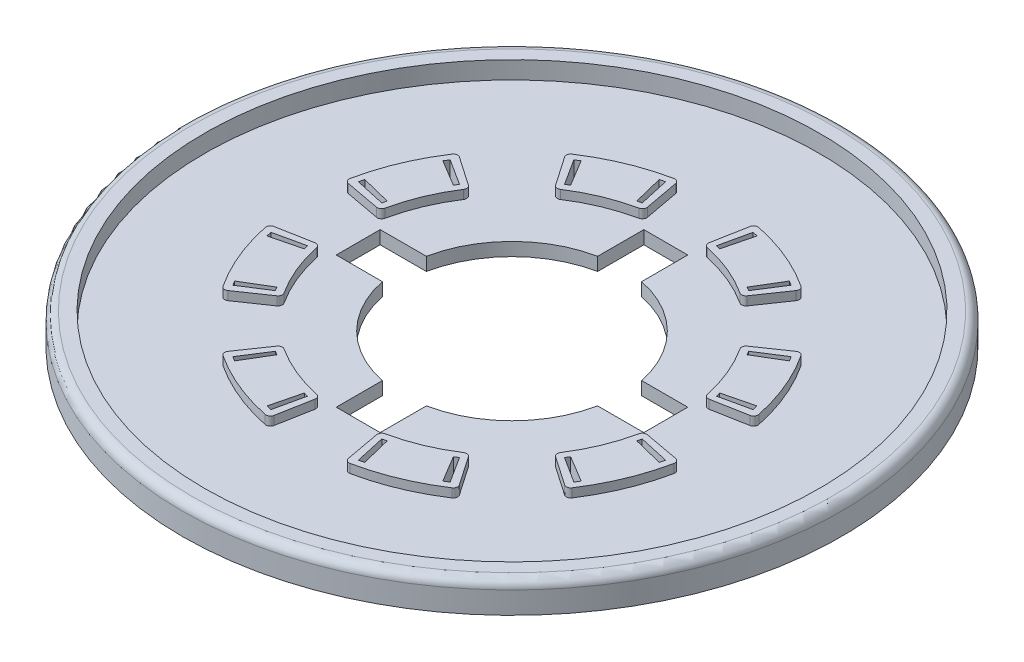
from build123d import *

# Parameters (mm, degrees)
CROQUIS1_R              = 75
SALIENTE_EXTRUIR1_DEPTH = 3
CROQUIS3_R              = 75
CROQUIS3_R_2            = 70
SALIENTE_EXTRUIR2_DEPTH = 4
CROQUIS2_R              = 2.5
CORTAR_EXTRUIR1_DEPTH   = 2
CROQUIS4_R              = 25
CORTAR_EXTRUIR2_DEPTH   = 6
SALIENTE_EXTRUIR4_DEPTH = 2
CORTAR_EXTRUIR3_DEPTH   = 11
REDONDEO1_R             = 2
CROQUIS11_W             = 10
CROQUIS11_H             = 30
CROQUIS11_W_2           = 30
CROQUIS11_H_2           = 10
CORTAR_EXTRUIR4_DEPTH   = 10


with BuildPart() as part:
    # Croquis1 → Saliente-Extruir1 (new body)
    with BuildSketch(Plane(origin=(0, 0, 0), x_dir=(1, 0, 0), z_dir=(0, 1, 0))):
        Circle(CROQUIS1_R)
    extrude(amount=SALIENTE_EXTRUIR1_DEPTH)

    # Croquis3 → Saliente-Extruir2 (add)
    with BuildSketch(Plane(origin=(0, 3, 0), x_dir=(1, 0, 0), z_dir=(0, 1, 0))):
        Circle(CROQUIS3_R)
        Circle(CROQUIS3_R_2, mode=Mode.SUBTRACT)
    extrude(amount=SALIENTE_EXTRUIR2_DEPTH)

    # Croquis2 → Cortar-Extruir1 (cut)
    with BuildSketch(Plane.XZ):
        with Locations((-55.432771951, 22.961005942)):
            Circle(CROQUIS2_R)
        with Locations((-22.961005942, 55.432771951)):
            Circle(CROQUIS2_R)
        with Locations((22.961005942, 55.432771951)):
            Circle(CROQUIS2_R)
        with Locations((55.432771951, 22.961005942)):
            Circle(CROQUIS2_R)
        with Locations((55.432771951, -22.961005942)):
            Circle(CROQUIS2_R)
        with Locations((22.961005942, -55.432771951)):
            Circle(CROQUIS2_R)
        with Locations((-22.961005942, -55.432771951)):
            Circle(CROQUIS2_R)
        with Locations((-55.432771951, -22.961005942)):
            Circle(CROQUIS2_R)
    extrude(amount=-CORTAR_EXTRUIR1_DEPTH, mode=Mode.SUBTRACT)

    # Croquis4 → Cortar-Extruir2 (cut)
    with BuildSketch(Plane.XZ):
        Circle(CROQUIS4_R)
    extrude(amount=-CORTAR_EXTRUIR2_DEPTH, mode=Mode.SUBTRACT)

    # Croquis8 → Saliente-Extruir4 (add)
    with BuildSketch(Plane(origin=(0, 3, 0), x_dir=(1, 0, 0), z_dir=(0, 1, 0))):
        with BuildLine():
            Line((-45.710779346, -8.471992187), (-37.842542242, -7.013700637))
            ThreePointArc((-37.842542242, -7.013700637), (-37.104652096, -7.165542325), (-36.682116932, -7.789242414))
            ThreePointArc((-36.682116932, -7.789242414), (-34.645482469, -14.350628714), (-31.445999762, -20.4303475))
            ThreePointArc((-31.445999762, -20.4303475), (-31.303754679, -21.170147542), (-31.718153519, -21.799282955))
            Line((-31.718153519, -21.799282955), (-38.313005174, -26.331798923))
            ThreePointArc((-38.313005174, -26.331798923), (-39.072209645, -26.488911157), (-39.715527786, -26.056224836))
            ThreePointArc((-39.715527786, -26.056224836), (-43.884277794, -18.177463037), (-46.507652289, -9.658585742))
            ThreePointArc((-46.507652289, -9.658585742), (-46.358713101, -8.897735691), (-45.710779346, -8.471992187))
        make_face()
        with BuildLine():
            Line((-38.313005174, 26.331798923), (-31.718153519, 21.799282955))
            ThreePointArc((-31.718153519, 21.799282955), (-31.303754679, 21.170147542), (-31.445999762, 20.4303475))
            ThreePointArc((-31.445999762, 20.4303475), (-34.645482469, 14.350628714), (-36.682116932, 7.789242414))
            ThreePointArc((-36.682116932, 7.789242414), (-37.104652096, 7.165542325), (-37.842542242, 7.013700637))
            Line((-37.842542242, 7.013700637), (-45.710779346, 8.471992187))
            ThreePointArc((-45.710779346, 8.471992187), (-46.358713101, 8.897735691), (-46.507652289, 9.658585742))
            ThreePointArc((-46.507652289, 9.658585742), (-43.884277794, 18.177463037), (-39.715527786, 26.056224836))
            ThreePointArc((-39.715527786, 26.056224836), (-39.072209645, 26.488911157), (-38.313005174, 26.331798923))
        make_face()
        with BuildLine():
            Line((-8.471992187, 45.710779346), (-7.013700637, 37.842542242))
            ThreePointArc((-7.013700637, 37.842542242), (-7.165542325, 37.104652096), (-7.789242414, 36.682116932))
            ThreePointArc((-7.789242414, 36.682116932), (-14.350628714, 34.645482469), (-20.4303475, 31.445999762))
            ThreePointArc((-20.4303475, 31.445999762), (-21.170147542, 31.303754679), (-21.799282955, 31.718153519))
            Line((-21.799282955, 31.718153519), (-26.331798923, 38.313005174))
            ThreePointArc((-26.331798923, 38.313005174), (-26.488911157, 39.072209645), (-26.056224836, 39.715527786))
            ThreePointArc((-26.056224836, 39.715527786), (-18.177463037, 43.884277794), (-9.658585742, 46.507652289))
            ThreePointArc((-9.658585742, 46.507652289), (-8.897735691, 46.358713101), (-8.471992187, 45.710779346))
        make_face()
        with BuildLine():
            Line((26.331798923, 38.313005174), (21.799282955, 31.718153519))
            ThreePointArc((21.799282955, 31.718153519), (21.170147542, 31.303754679), (20.4303475, 31.445999762))
            ThreePointArc((20.4303475, 31.445999762), (14.350628714, 34.645482469), (7.789242414, 36.682116932))
            ThreePointArc((7.789242414, 36.682116932), (7.165542325, 37.104652096), (7.013700637, 37.842542242))
            Line((7.013700637, 37.842542242), (8.471992187, 45.710779346))
            ThreePointArc((8.471992187, 45.710779346), (8.897735691, 46.358713101), (9.658585742, 46.507652289))
            ThreePointArc((9.658585742, 46.507652289), (18.177463037, 43.884277794), (26.056224836, 39.715527786))
            ThreePointArc((26.056224836, 39.715527786), (26.488911157, 39.072209645), (26.331798923, 38.313005174))
        make_face()
        with BuildLine():
            Line((45.710779346, 8.471992187), (37.842542242, 7.013700637))
            ThreePointArc((37.842542242, 7.013700637), (37.104652096, 7.165542325), (36.682116932, 7.789242414))
            ThreePointArc((36.682116932, 7.789242414), (34.645482469, 14.350628714), (31.445999762, 20.4303475))
            ThreePointArc((31.445999762, 20.4303475), (31.303754679, 21.170147542), (31.718153519, 21.799282955))
            Line((31.718153519, 21.799282955), (38.313005174, 26.331798923))
            ThreePointArc((38.313005174, 26.331798923), (39.072209645, 26.488911157), (39.715527786, 26.056224836))
            ThreePointArc((39.715527786, 26.056224836), (43.884277794, 18.177463037), (46.507652289, 9.658585742))
            ThreePointArc((46.507652289, 9.658585742), (46.358713101, 8.897735691), (45.710779346, 8.471992187))
        make_face()
        with BuildLine():
            Line((38.313005174, -26.331798923), (31.718153519, -21.799282955))
            ThreePointArc((31.718153519, -21.799282955), (31.303754679, -21.170147542), (31.445999762, -20.4303475))
            ThreePointArc((31.445999762, -20.4303475), (34.645482469, -14.350628714), (36.682116932, -7.789242414))
            ThreePointArc((36.682116932, -7.789242414), (37.104652096, -7.165542325), (37.842542242, -7.013700637))
            Line((37.842542242, -7.013700637), (45.710779346, -8.471992187))
            ThreePointArc((45.710779346, -8.471992187), (46.358713101, -8.897735691), (46.507652289, -9.658585742))
            ThreePointArc((46.507652289, -9.658585742), (43.884277794, -18.177463037), (39.715527786, -26.056224836))
            ThreePointArc((39.715527786, -26.056224836), (39.072209645, -26.488911157), (38.313005174, -26.331798923))
        make_face()
        with BuildLine():
            Line((8.471992187, -45.710779346), (7.013700637, -37.842542242))
            ThreePointArc((7.013700637, -37.842542242), (7.165542325, -37.104652096), (7.789242414, -36.682116932))
            ThreePointArc((7.789242414, -36.682116932), (14.350628714, -34.645482469), (20.4303475, -31.445999762))
            ThreePointArc((20.4303475, -31.445999762), (21.170147542, -31.303754679), (21.799282955, -31.718153519))
            Line((21.799282955, -31.718153519), (26.331798923, -38.313005174))
            ThreePointArc((26.331798923, -38.313005174), (26.488911157, -39.072209645), (26.056224836, -39.715527786))
            ThreePointArc((26.056224836, -39.715527786), (18.177463037, -43.884277794), (9.658585742, -46.507652289))
            ThreePointArc((9.658585742, -46.507652289), (8.897735691, -46.358713101), (8.471992187, -45.710779346))
        make_face()
        with BuildLine():
            Line((-26.331798923, -38.313005174), (-21.799282955, -31.718153519))
            ThreePointArc((-21.799282955, -31.718153519), (-21.170147542, -31.303754679), (-20.4303475, -31.445999762))
            ThreePointArc((-20.4303475, -31.445999762), (-14.350628714, -34.645482469), (-7.789242414, -36.682116932))
            ThreePointArc((-7.789242414, -36.682116932), (-7.165542325, -37.104652096), (-7.013700637, -37.842542242))
            Line((-7.013700637, -37.842542242), (-8.471992187, -45.710779346))
            ThreePointArc((-8.471992187, -45.710779346), (-8.897735691, -46.358713101), (-9.658585742, -46.507652289))
            ThreePointArc((-9.658585742, -46.507652289), (-18.177463037, -43.884277794), (-26.056224836, -39.715527786))
            ThreePointArc((-26.056224836, -39.715527786), (-26.488911157, -39.072209645), (-26.331798923, -38.313005174))
        make_face()
    extrude(amount=SALIENTE_EXTRUIR4_DEPTH)

    # Croquis10 → Cortar-Extruir3 (cut)
    with BuildSketch(Plane(origin=(0, 5, 0), x_dir=(1, 0, 0), z_dir=(0, 1, 0))):
        with BuildLine():
            Line((-44.909616328, -9.956222241), (-38.075544278, -8.441144944))
            ThreePointArc((-38.075544278, -8.441144944), (-37.96179108, -8.938815246), (-37.841533325, -9.434953928))
            Line((-37.841533325, -9.434953928), (-44.633603409, -11.128407198))
            ThreePointArc((-44.633603409, -11.128407198), (-44.775445889, -10.543217982), (-44.909616328, -9.956222241))
        make_face()
        with BuildLine():
            Line((-39.429695832, 23.691751446), (-33.429524727, 20.086484921))
            ThreePointArc((-33.429524727, 20.086484921), (-33.163736775, 20.522343022), (-32.892266387, 20.954684726))
            Line((-32.892266387, 20.954684726), (-38.796006507, 24.715781984))
            ThreePointArc((-38.796006507, 24.715781984), (-39.11620235, 24.205840488), (-39.429695832, 23.691751446))
        make_face()
        with BuildLine():
            Line((-38.796006507, -24.715781984), (-32.892266387, -20.954684726))
            ThreePointArc((-32.892266387, -20.954684726), (-33.163736775, -20.522343022), (-33.429524727, -20.086484921))
            Line((-33.429524727, -20.086484921), (-39.429695832, -23.691751446))
            ThreePointArc((-39.429695832, -23.691751446), (-39.11620235, -24.205840488), (-38.796006507, -24.715781984))
        make_face()
        with BuildLine():
            Line((-44.909616328, 9.956222241), (-38.075544278, 8.441144944))
            ThreePointArc((-38.075544278, 8.441144944), (-37.96179108, 8.938815246), (-37.841533325, 9.434953928))
            Line((-37.841533325, 9.434953928), (-44.633603409, 11.128407198))
            ThreePointArc((-44.633603409, 11.128407198), (-44.775445889, 10.543217982), (-44.909616328, 9.956222241))
        make_face()
        with BuildLine():
            Line((-11.128407198, 44.633603409), (-9.434953928, 37.841533325))
            ThreePointArc((-9.434953928, 37.841533325), (-8.938815246, 37.96179108), (-8.441144944, 38.075544278))
            Line((-8.441144944, 38.075544278), (-9.956222241, 44.909616328))
            ThreePointArc((-9.956222241, 44.909616328), (-10.543217982, 44.775445889), (-11.128407198, 44.633603409))
        make_face()
        with BuildLine():
            Line((-24.715781984, 38.796006507), (-20.954684726, 32.892266387))
            ThreePointArc((-20.954684726, 32.892266387), (-20.522343022, 33.163736775), (-20.086484921, 33.429524727))
            Line((-20.086484921, 33.429524727), (-23.691751446, 39.429695832))
            ThreePointArc((-23.691751446, 39.429695832), (-24.205840488, 39.11620235), (-24.715781984, 38.796006507))
        make_face()
        with BuildLine():
            Line((23.691751446, 39.429695832), (20.086484921, 33.429524727))
            ThreePointArc((20.086484921, 33.429524727), (20.522343022, 33.163736775), (20.954684726, 32.892266387))
            Line((20.954684726, 32.892266387), (24.715781984, 38.796006507))
            ThreePointArc((24.715781984, 38.796006507), (24.205840488, 39.11620235), (23.691751446, 39.429695832))
        make_face()
        with BuildLine():
            Line((9.956222241, 44.909616328), (8.441144944, 38.075544278))
            ThreePointArc((8.441144944, 38.075544278), (8.938815246, 37.96179108), (9.434953928, 37.841533325))
            Line((9.434953928, 37.841533325), (11.128407198, 44.633603409))
            ThreePointArc((11.128407198, 44.633603409), (10.543217982, 44.775445889), (9.956222241, 44.909616328))
        make_face()
        with BuildLine():
            Line((44.633603409, 11.128407198), (37.841533325, 9.434953928))
            ThreePointArc((37.841533325, 9.434953928), (37.96179108, 8.938815246), (38.075544278, 8.441144944))
            Line((38.075544278, 8.441144944), (44.909616328, 9.956222241))
            ThreePointArc((44.909616328, 9.956222241), (44.775445889, 10.543217982), (44.633603409, 11.128407198))
        make_face()
        with BuildLine():
            Line((38.796006507, 24.715781984), (32.892266387, 20.954684726))
            ThreePointArc((32.892266387, 20.954684726), (33.163736775, 20.522343022), (33.429524727, 20.086484921))
            Line((33.429524727, 20.086484921), (39.429695832, 23.691751446))
            ThreePointArc((39.429695832, 23.691751446), (39.11620235, 24.205840488), (38.796006507, 24.715781984))
        make_face()
        with BuildLine():
            Line((39.429695832, -23.691751446), (33.429524727, -20.086484921))
            ThreePointArc((33.429524727, -20.086484921), (33.163736775, -20.522343022), (32.892266387, -20.954684726))
            Line((32.892266387, -20.954684726), (38.796006507, -24.715781984))
            ThreePointArc((38.796006507, -24.715781984), (39.11620235, -24.205840488), (39.429695832, -23.691751446))
        make_face()
        with BuildLine():
            Line((44.909616328, -9.956222241), (38.075544278, -8.441144944))
            ThreePointArc((38.075544278, -8.441144944), (37.96179108, -8.938815246), (37.841533325, -9.434953928))
            Line((37.841533325, -9.434953928), (44.633603409, -11.128407198))
            ThreePointArc((44.633603409, -11.128407198), (44.775445889, -10.543217982), (44.909616328, -9.956222241))
        make_face()
        with BuildLine():
            Line((11.128407198, -44.633603409), (9.434953928, -37.841533325))
            ThreePointArc((9.434953928, -37.841533325), (8.938815246, -37.96179108), (8.441144944, -38.075544278))
            Line((8.441144944, -38.075544278), (9.956222241, -44.909616328))
            ThreePointArc((9.956222241, -44.909616328), (10.543217982, -44.775445889), (11.128407198, -44.633603409))
        make_face()
        with BuildLine():
            Line((24.715781984, -38.796006507), (20.954684726, -32.892266387))
            ThreePointArc((20.954684726, -32.892266387), (20.522343022, -33.163736775), (20.086484921, -33.429524727))
            Line((20.086484921, -33.429524727), (23.691751446, -39.429695832))
            ThreePointArc((23.691751446, -39.429695832), (24.205840488, -39.11620235), (24.715781984, -38.796006507))
        make_face()
        with BuildLine():
            Line((-23.691751446, -39.429695832), (-20.086484921, -33.429524727))
            ThreePointArc((-20.086484921, -33.429524727), (-20.522343022, -33.163736775), (-20.954684726, -32.892266387))
            Line((-20.954684726, -32.892266387), (-24.715781984, -38.796006507))
            ThreePointArc((-24.715781984, -38.796006507), (-24.205840488, -39.11620235), (-23.691751446, -39.429695832))
        make_face()
        with BuildLine():
            Line((-9.956222241, -44.909616328), (-8.441144944, -38.075544278))
            ThreePointArc((-8.441144944, -38.075544278), (-8.938815246, -37.96179108), (-9.434953928, -37.841533325))
            Line((-9.434953928, -37.841533325), (-11.128407198, -44.633603409))
            ThreePointArc((-11.128407198, -44.633603409), (-10.543217982, -44.775445889), (-9.956222241, -44.909616328))
        make_face()
    extrude(amount=-CORTAR_EXTRUIR3_DEPTH, mode=Mode.SUBTRACT)

    # Redondeo1
    redondeo1_edges = [part.edges().sort_by_distance(p)[0] for p in [
        (-75, 7, 0),
    ]]
    fillet(redondeo1_edges, radius=REDONDEO1_R)

    # Croquis11 → Cortar-Extruir4 (cut)
    with BuildSketch(Plane(origin=(0, 3, 0), x_dir=(1, 0, 0), z_dir=(0, 1, 0))):
        with Locations((0, -20)):
            Rectangle(CROQUIS11_W, CROQUIS11_H)
        with Locations((-20, 0)):
            Rectangle(CROQUIS11_W_2, CROQUIS11_H_2)
        with Locations((20, 0)):
            Rectangle(CROQUIS11_W_2, CROQUIS11_H_2)
        with Locations((0, 20)):
            Rectangle(CROQUIS11_W, CROQUIS11_H)
    extrude(amount=-CORTAR_EXTRUIR4_DEPTH, mode=Mode.SUBTRACT)


solid = part.part
